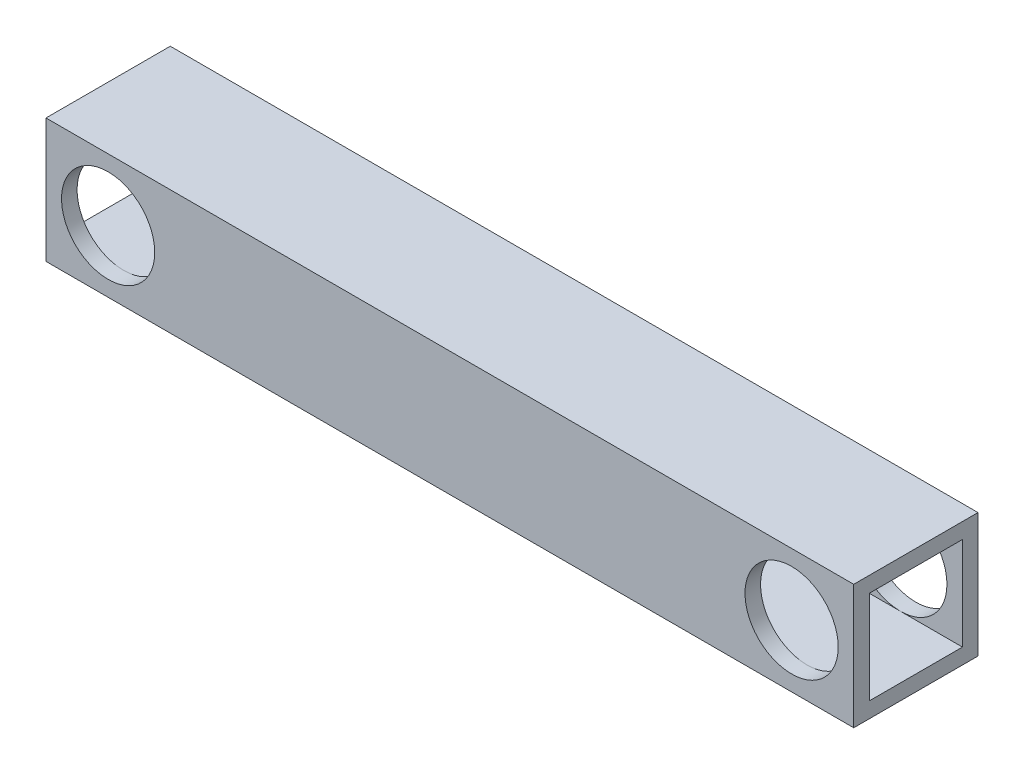
from build123d import *

# Parameters (mm, degrees)
SKETCH1_W           = 165.1
SKETCH1_H           = 25.4
SKETCH1_R           = 9.525
BOSS_EXTRUDE1_DEPTH = 25.4
SKETCH2_W           = 19.05
SKETCH2_H           = 19.05
CUT_EXTRUDE1_DEPTH  = 168.52450567


with BuildPart() as part:
    # Sketch1 → Boss-Extrude1 (new body)
    with BuildSketch(Plane.XY):
        with Locations((69.85, 0)):
            Rectangle(SKETCH1_W, SKETCH1_H)
        Circle(SKETCH1_R, mode=Mode.SUBTRACT)
        with Locations((139.7, 0)):
            Circle(SKETCH1_R, mode=Mode.SUBTRACT)
    extrude(amount=BOSS_EXTRUDE1_DEPTH)

    # Sketch2 → Cut-Extrude1 (cut, through all)
    with BuildSketch(Plane(origin=(152.4, 0, 0), x_dir=(0, 0, -1), z_dir=(1, 0, 0))):
        with Locations((-12.7, 0)):
            Rectangle(SKETCH2_W, SKETCH2_H)
    extrude(amount=-CUT_EXTRUDE1_DEPTH, mode=Mode.SUBTRACT)


solid = part.part
